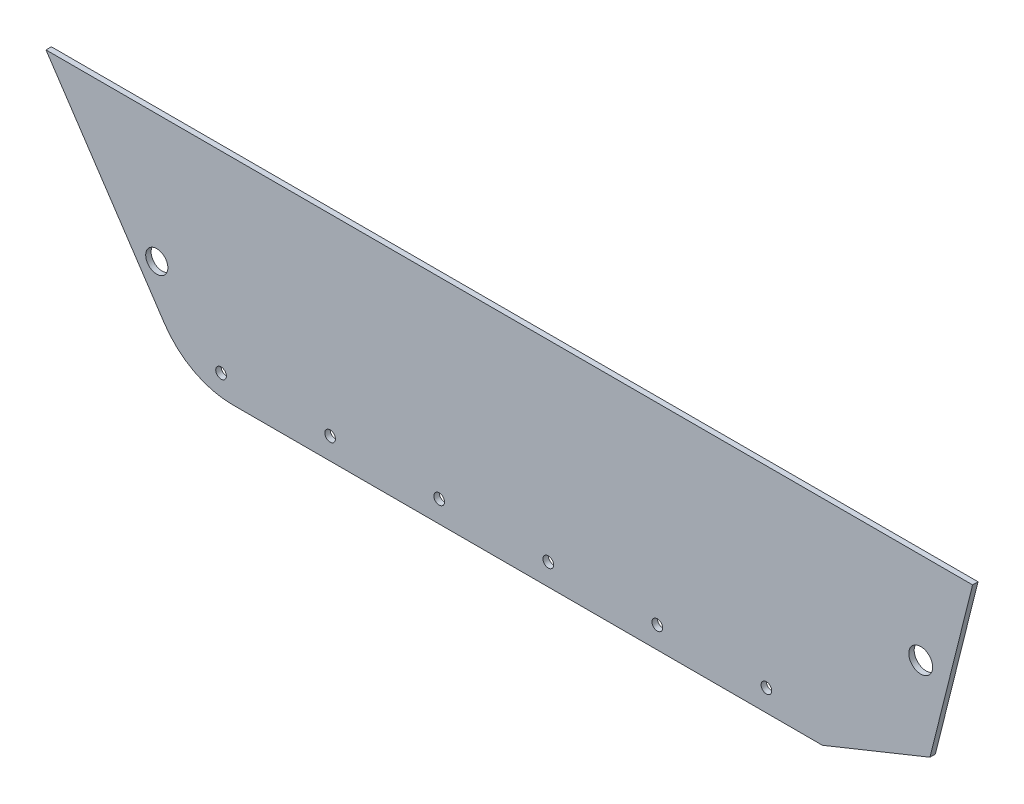
from build123d import *

# Parameters (mm, degrees)
BOSS_EXTRUDE1_DEPTH = 3.175
SKETCH1_4_R         = 3.125
CUT_EXTRUDE1_DEPTH  = 439.905857431
FILLET1_R           = 48
CUT_EXTRUDE3_DEPTH  = 10
CUT_EXTRUDE5_REACH  = 440.906
SKETCH12_R          = 7
SKETCH13_R          = 6.5
CUT_EXTRUDE6_DEPTH  = 10


with BuildPart() as part:
    # Sketch1 → Boss-Extrude1 (new body)
    with BuildSketch(Plane.XY):
        Polygon((-98.879411765, 3.850980392), (-31.879411765, -96.649019608), (366, -96.649019608), (403.120588235, -71.149019608), (428.120588235, 28.939617947), (-115.605170134, 28.939617947), align=None)
    extrude(amount=BOSS_EXTRUDE1_DEPTH)

    # Sketch1<4> → Cut-Extrude1 (cut, through all)
    with BuildSketch(Plane.XY):
        with Locations((-12.879411765, -83.899019608)):
            Circle(SKETCH1_4_R)
        with Locations((51.120588235, -83.899019608)):
            Circle(SKETCH1_4_R)
        with Locations((115.120588235, -83.899019608)):
            Circle(SKETCH1_4_R)
        with Locations((179.120588235, -83.899019608)):
            Circle(SKETCH1_4_R)
        with Locations((243.120588235, -83.899019608)):
            Circle(SKETCH1_4_R)
        with Locations((307.120588235, -83.899019608)):
            Circle(SKETCH1_4_R)
    extrude(amount=CUT_EXTRUDE1_DEPTH, mode=Mode.SUBTRACT)

    # Fillet1
    fillet1_edges = [part.edges().sort_by_distance(p)[0] for p in [
        (-31.879411765, -96.649019608, 1.5875),
    ]]
    fillet(fillet1_edges, radius=FILLET1_R)

    # Sketch7 → Cut-Extrude3 (cut)
    with BuildSketch(Plane.XY.offset(3.175)):
        Polygon((403.120588235, -71.149019608), (340.005873473, -96.649019608), (366, -96.649019608), align=None)
    extrude(amount=-CUT_EXTRUDE3_DEPTH, mode=Mode.SUBTRACT)

    # Sketch12 → Cut-Extrude5 (cut, up to next)
    with BuildSketch(Plane.XY.offset(3.175), mode=Mode.PRIVATE) as cut_extrude5_sk1:
        with Locations((397.677759779, -24.610405856)):
            Circle(SKETCH12_R)
    cut_extrude5_tool1 = extrude(cut_extrude5_sk1.sketch, amount=-CUT_EXTRUDE5_REACH, mode=Mode.PRIVATE) & part.part
    add(cut_extrude5_tool1.solids().sort_by_distance((397.67776, -24.610406, 3.175))[0], mode=Mode.SUBTRACT)

    # Sketch13 → Cut-Extrude6 (cut)
    with BuildSketch(Plane.XY.offset(3.175)):
        with Locations((-50.605170134, -46.060382053)):
            Circle(SKETCH13_R)
    extrude(amount=-CUT_EXTRUDE6_DEPTH, mode=Mode.SUBTRACT)


solid = part.part
